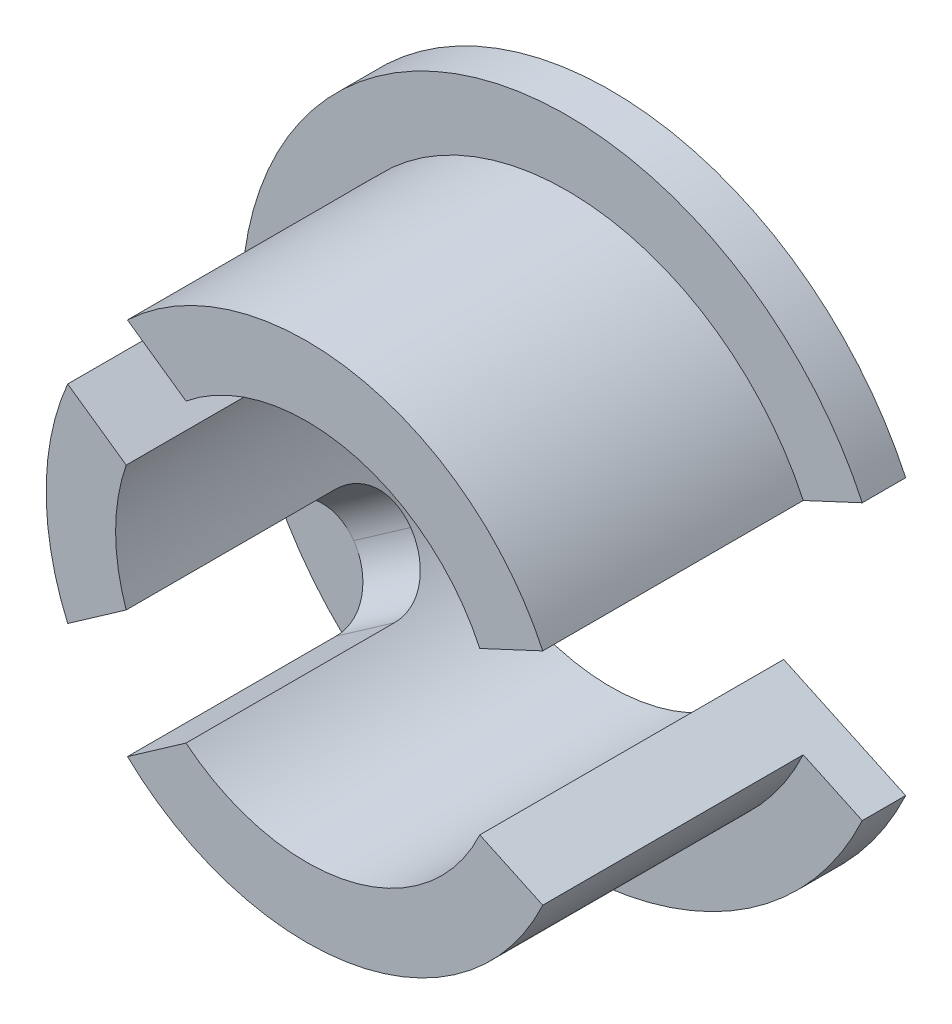
from build123d import *

# Parameters (mm, degrees)
BOSS_EXTRUDE1_DEPTH = 6
BOSS_EXTRUDE2_START = 1
BOSS_EXTRUDE2_DEPTH = 1
CUT_EXTRUDE1_START  = -6
CUT_EXTRUDE1_DEPTH  = 6
FILLET1_R           = 1.2


with BuildPart() as part:
    # Sketch1 → Boss-Extrude1 (new body)
    with BuildSketch(Plane.XY):
        with BuildLine():
            Line((3.987754263, 1.859520352), (5.437846722, 2.53570957))
            ThreePointArc((5.437846722, 2.53570957), (-6, 0), (5.437846722, -2.53570957))
            Line((5.437846722, -2.53570957), (3.987754263, -1.859520352))
            ThreePointArc((3.987754263, -1.859520352), (-4.4, 0), (3.987754263, 1.859520352))
        make_face()
    extrude(amount=BOSS_EXTRUDE1_DEPTH)

    # Sketch2 → Boss-Extrude2 (add)
    with BuildSketch(Plane(origin=(0, 0, 0), x_dir=(-1, 0, 0), z_dir=(0, 0, -1)).offset(BOSS_EXTRUDE2_START)):
        with BuildLine():
            Line((-3.987754263, -1.859520352), (-5.437846722, -2.53570957))
            ThreePointArc((-5.437846722, -2.53570957), (6, 0), (-5.437846722, 2.53570957))
            Line((-5.437846722, 2.53570957), (-3.987754263, 1.859520352))
            ThreePointArc((-3.987754263, 1.859520352), (4.4, 0), (-3.987754263, -1.859520352))
        make_face()
        with BuildLine():
            Line((-6.797308403, 3.169636963), (-5.437846722, 2.53570957))
            ThreePointArc((-5.437846722, 2.53570957), (6, 0), (-5.437846722, -2.53570957))
            Line((-5.437846722, -2.53570957), (-6.797308403, -3.169636963))
            ThreePointArc((-6.797308403, -3.169636963), (1.623297105, -7.322220053), (7.5, 0))
            ThreePointArc((7.5, 0), (1.623297105, 7.322220053), (-6.797308403, 3.169636963))
        make_face()
    extrude(amount=-BOSS_EXTRUDE2_DEPTH)

    # Sketch3 → Cut-Extrude1 (cut)
    with BuildSketch(Plane.XY.offset(6).offset(CUT_EXTRUDE1_START)):
        with BuildLine():
            ThreePointArc((-5.503902596, -2.388944581), (-4.914912266, -3.441458618), (-4.127319149, -4.354909487))
            Line((-4.127319149, -4.354909487), (-2.779344429, -3.411047427))
            ThreePointArc((-2.779344429, -3.411047427), (-3.604268995, -2.52373632), (-4.155927876, -1.44508252))
            Line((-4.155927876, -1.44508252), (-5.503902596, -2.388944581))
        make_face()
        with BuildLine():
            ThreePointArc((-5.376200178, 5.229385398), (-6.143640332, 4.301823273), (-6.752783625, 3.263420492))
            Line((-6.752783625, 3.263420492), (-5.503902596, 2.388944581))
            ThreePointArc((-5.503902596, 2.388944581), (-4.914912266, 3.441458618), (-4.127319149, 4.354909487))
            Line((-4.127319149, 4.354909487), (-5.376200178, 5.229385398))
        make_face()
        with BuildLine():
            ThreePointArc((-4.127319149, 4.354909487), (-4.914912266, 3.441458618), (-5.503902596, 2.388944581))
            Line((-5.503902596, 2.388944581), (-4.155927876, 1.44508252))
            ThreePointArc((-4.155927876, 1.44508252), (-3.604268995, 2.52373632), (-2.779344429, 3.411047427))
            Line((-2.779344429, 3.411047427), (-4.127319149, 4.354909487))
        make_face()
        with BuildLine():
            ThreePointArc((-6.752783625, -3.263420492), (-6.143640332, -4.301823273), (-5.376200178, -5.229385398))
            Line((-5.376200178, -5.229385398), (-4.127319149, -4.354909487))
            ThreePointArc((-4.127319149, -4.354909487), (-4.914912266, -3.441458618), (-5.503902596, -2.388944581))
            Line((-5.503902596, -2.388944581), (-6.752783625, -3.263420492))
        make_face()
    extrude(amount=CUT_EXTRUDE1_DEPTH, mode=Mode.SUBTRACT)

    # Fillet1
    # the kernel refuses this fillet: 1.2 mm, written as the material it adds along each edge
    with BuildSketch(Plane(origin=(-6.584775282, -6.075638796, 0), x_dir=(-0.5735764363510464, 0.8191520442889915, 0), z_dir=(0.8191520442889916, 0.5735764363510465, 0))) as fillet1_piece_1_section:
        with BuildLine():
            CenterArc((FILLET1_R, FILLET1_R), FILLET1_R, 180, 90)
            Line((0, FILLET1_R), (0, 0))
            Line((0, 0), (FILLET1_R, 0))
        make_face()
    fillet1_piece_1 = extrude(amount=7.645573285, mode=Mode.PRIVATE)
    fillet1_piece_1 = fillet1_piece_1 - Plane(origin=(0, 0, 0.272987172), x_dir=(0.9063077870366507, 0.4226182617406977, 0), z_dir=(0, 0, -1)) * Cylinder(4.4, 21, mode=Mode.PRIVATE)
    fillet1_piece_1 = fillet1_piece_1 & Plane(origin=(0, 0, 0.272987172), x_dir=(0.9063077870366507, 0.4226182617406977, 0), z_dir=(0, 0, -1)) * Cylinder(6, 21, mode=Mode.PRIVATE)
    add(fillet1_piece_1)
    with BuildSketch(Plane(origin=(-1.698471743, 0.275646789, 0), x_dir=(0.5735764363510474, -0.8191520442889908, 0), z_dir=(-0.819152044288991, -0.5735764363510474, 0))) as fillet1_piece_2_section:
        with BuildLine():
            CenterArc((FILLET1_R, FILLET1_R), FILLET1_R, 180, 90)
            Line((0, FILLET1_R), (0, 0))
            Line((0, 0), (FILLET1_R, 0))
        make_face()
    fillet1_piece_2 = extrude(amount=7.645573285, mode=Mode.PRIVATE)
    fillet1_piece_2 = fillet1_piece_2 - Plane(origin=(0, 0, 0.272986937), x_dir=(0.9063077870366507, 0.4226182617406977, 0), z_dir=(0, 0, -1)) * Cylinder(4.4, 21, mode=Mode.PRIVATE)
    fillet1_piece_2 = fillet1_piece_2 & Plane(origin=(0, 0, 0.272986937), x_dir=(0.9063077870366507, 0.4226182617406977, 0), z_dir=(0, 0, -1)) * Cylinder(6, 21, mode=Mode.PRIVATE)
    add(fillet1_piece_2)
    with BuildSketch(Plane(origin=(-0.321888296, 1.690318118, 0), x_dir=(0, 0, 1), z_dir=(-0.8191520442889906, 0.5735764363510478, 0))) as fillet1_piece_3_section:
        with BuildLine():
            CenterArc((FILLET1_R, -FILLET1_R), FILLET1_R, 90, 90)
            Line((0, -FILLET1_R), (0, 0))
            Line((0, 0), (FILLET1_R, 0))
        make_face()
    fillet1_piece_3 = extrude(amount=7.645573285, mode=Mode.PRIVATE)
    fillet1_piece_3 = fillet1_piece_3 - Plane(origin=(0, 0, 0.272987798), x_dir=(0.9063077870366507, -0.4226182617406978, 0), z_dir=(0, 0, -1)) * Cylinder(4.4, 21, mode=Mode.PRIVATE)
    fillet1_piece_3 = fillet1_piece_3 & Plane(origin=(0, 0, 0.272987798), x_dir=(0.9063077870366507, 0.4226182617406977, 0), z_dir=(0, 0, -1)) * Cylinder(6, 21, mode=Mode.PRIVATE)
    add(fillet1_piece_3)
    with BuildSketch(Plane(origin=(-1.698471743, -0.275646789, 0), x_dir=(0.5735764363510463, 0.8191520442889917, 0), z_dir=(-0.8191520442889917, 0.5735764363510463, 0))) as fillet1_piece_4_section:
        with BuildLine():
            CenterArc((FILLET1_R, -FILLET1_R), FILLET1_R, 90, 90)
            Line((0, -FILLET1_R), (0, 0))
            Line((0, 0), (FILLET1_R, 0))
        make_face()
    fillet1_piece_4 = extrude(amount=7.645573285, mode=Mode.PRIVATE)
    fillet1_piece_4 = fillet1_piece_4 - Plane(origin=(0, 0, 0.27298714), x_dir=(0.9063077870366507, 0.4226182617406977, 0), z_dir=(0, 0, -1)) * Cylinder(4.4, 21, mode=Mode.PRIVATE)
    fillet1_piece_4 = fillet1_piece_4 & Plane(origin=(0, 0, 0.27298714), x_dir=(0.9063077870366507, 0.4226182617406977, 0), z_dir=(0, 0, -1)) * Cylinder(6, 21, mode=Mode.PRIVATE)
    add(fillet1_piece_4)


solid = part.part
